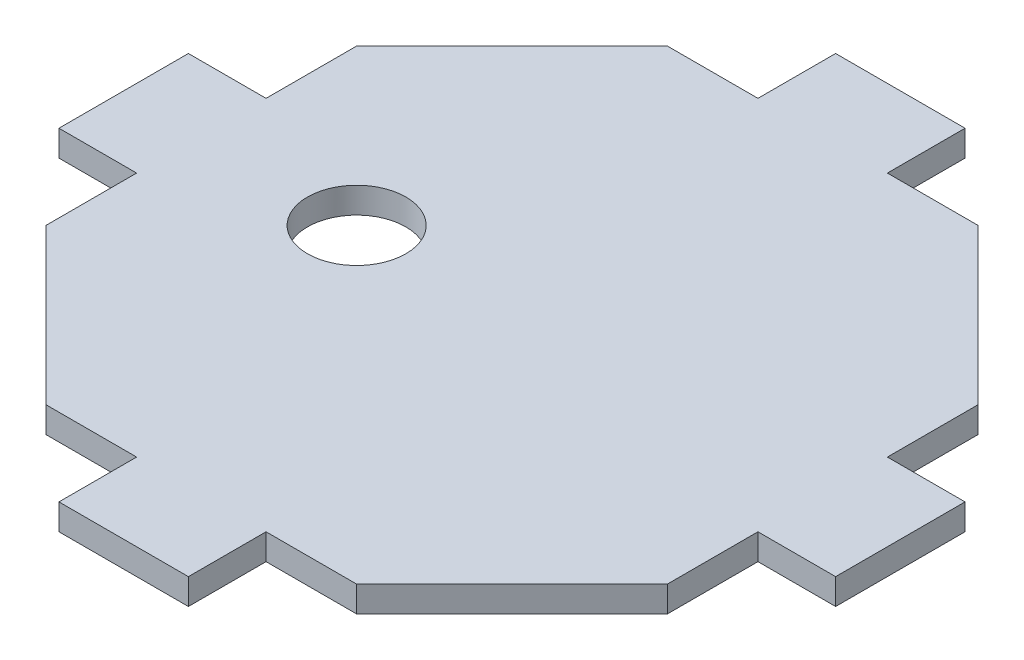
from build123d import *

# Parameters (mm, degrees)
EXTRUDE_1_DEPTH     = 5
SKETCH_2_R          = 9.5
CUT_EXTRUDE_1_DEPTH = 10


with BuildPart() as part:
    # 스케치1 → 보스-돌출1 (new body)
    with BuildSketch(Plane(origin=(0, 0, 0), x_dir=(1, 0, 0), z_dir=(0, 1, 0))):
        Polygon((-60, -30), (-30, -60), (-12.5, -60), (-12.5, -75), (12.5, -75), (12.5, -60), (30, -60), (60, -30), (60, -12.5), (75, -12.5), (75, 12.5), (60, 12.5), (60, 30), (30, 60), (12.5, 60), (12.5, 75), (-12.5, 75), (-12.5, 60), (-30, 60), (-60, 30), (-60, 12.5), (-75, 12.5), (-75, -12.5), (-60, -12.5), align=None)
    extrude(amount=EXTRUDE_1_DEPTH)

    # 스케치2 → 컷-돌출1 (cut)
    with BuildSketch(Plane(origin=(0, 0, 0), x_dir=(-1, 0, 0), z_dir=(0, -1, 0))):
        with Locations((30, 0)):
            Circle(SKETCH_2_R)
    extrude(amount=-CUT_EXTRUDE_1_DEPTH, mode=Mode.SUBTRACT)


solid = part.part
